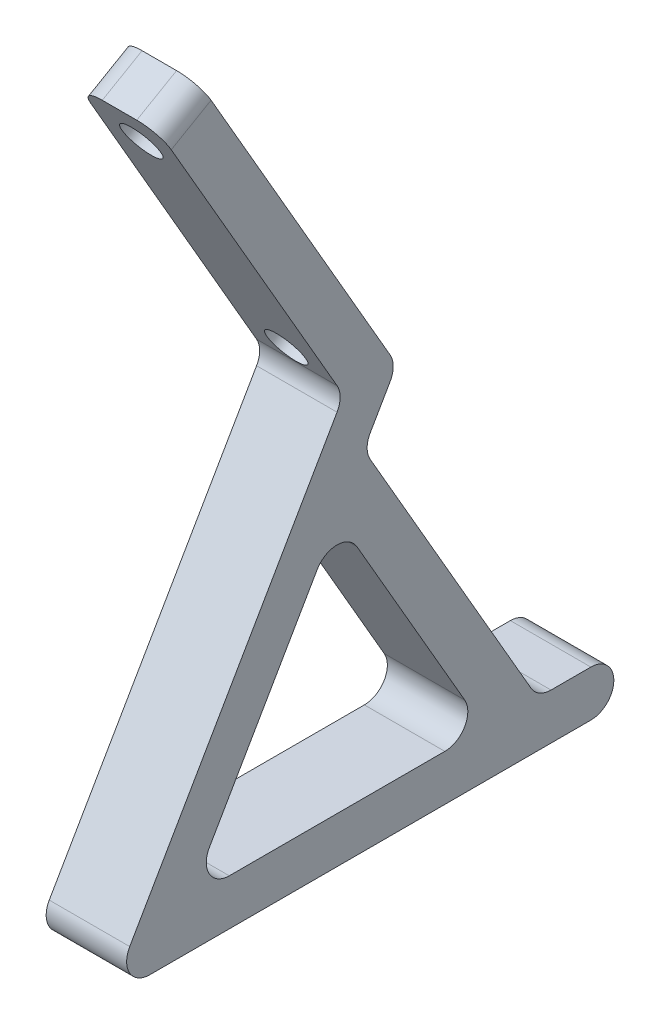
from build123d import *

# Parameters (mm, degrees)
BOSS_EXTRU_1_DEPTH = 7
D_GAGEMENT_M31_D   = 3.4
CONG_1_R           = 2


with BuildPart() as part:
    # Esquisse1 → Boss.-Extru.1 (new body)
    with BuildSketch(Plane(origin=(0, 0, 0), x_dir=(0, 0, -1), z_dir=(1, 0, 0))):
        Polygon((-37.5, 64.951905284), (-40.964101615, 62.951905284), (-24.964101615, 35.239092363), (-45.309401077, 0), (0, 0), (-2.309401077, 4), (-8.082903769, 4), (-23.232050808, 30.239092363), (-20.345299462, 35.239092363), align=None)
        Polygon((-38.381197846, 4), (-12.701705922, 4), (-25.541451884, 26.239092363), align=None, mode=Mode.SUBTRACT)
    extrude(amount=BOSS_EXTRU_1_DEPTH)

    # Dégagement M31 (through all)
    with Locations(Plane(origin=(0, 0, 0), x_dir=(-1, 0, 0), z_dir=(0, 0.5000000000000047, -0.866025403784436))):
        with Locations((-3.5, 71.2), (-3.5, 46)):
            Hole(D_GAGEMENT_M31_D / 2)

    # Congé1
    cong_1_edges = [part.edges().sort_by_distance(p)[0] for p in [
        (0, 63.951905284, 39.232050808),
        (3.5, 0, 0),
        (3.5, 0, 45.309401077),
        (3.5, 35.239092363, 24.964101615),
        (3.5, 35.239092363, 20.345299462),
        (3.5, 30.239092363, 23.232050808),
        (3.5, 4, 8.082903769),
        (3.5, 4, 2.309401077),
        (7, 63.951905284, 39.232050808),
        (3.5, 26.239092363, 25.541451884),
        (3.5, 4, 38.381197846),
        (3.5, 4, 12.701705922),
    ]]
    fillet(cong_1_edges, radius=CONG_1_R - 0.0001)  # a hair under: the kernel refuses the full size


solid = part.part
